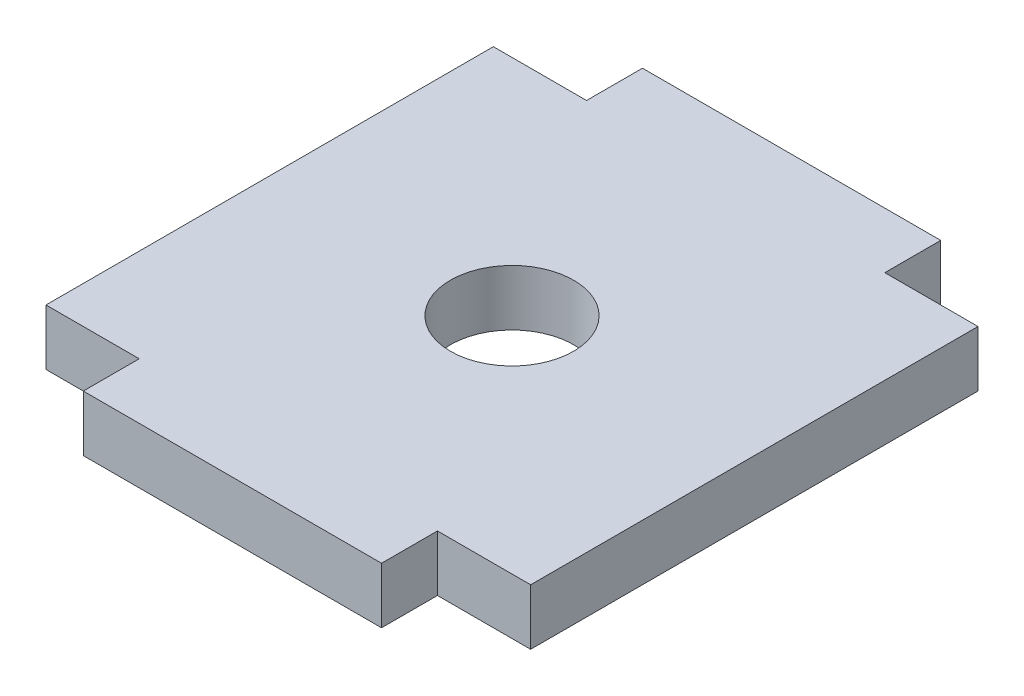
from build123d import *

# Parameters (mm, degrees)
CROQUIS1_R              = 3.304797086
SALIENTE_EXTRUIR1_DEPTH = 3


with BuildPart() as part:
    # Croquis1 → Saliente-Extruir1 (new body)
    with BuildSketch(Plane(origin=(0, 0, 0), x_dir=(1, 0, 0), z_dir=(0, 1, 0))):
        Polygon((0, 0), (0, 24), (5, 24), (5, 27), (21, 27), (21, 24), (26, 24), (26, 0), (21, 0), (21, -3), (5, -3), (5, 0), align=None)
        with Locations((13, 12)):
            Circle(CROQUIS1_R, mode=Mode.SUBTRACT)
    extrude(amount=SALIENTE_EXTRUIR1_DEPTH)


solid = part.part
